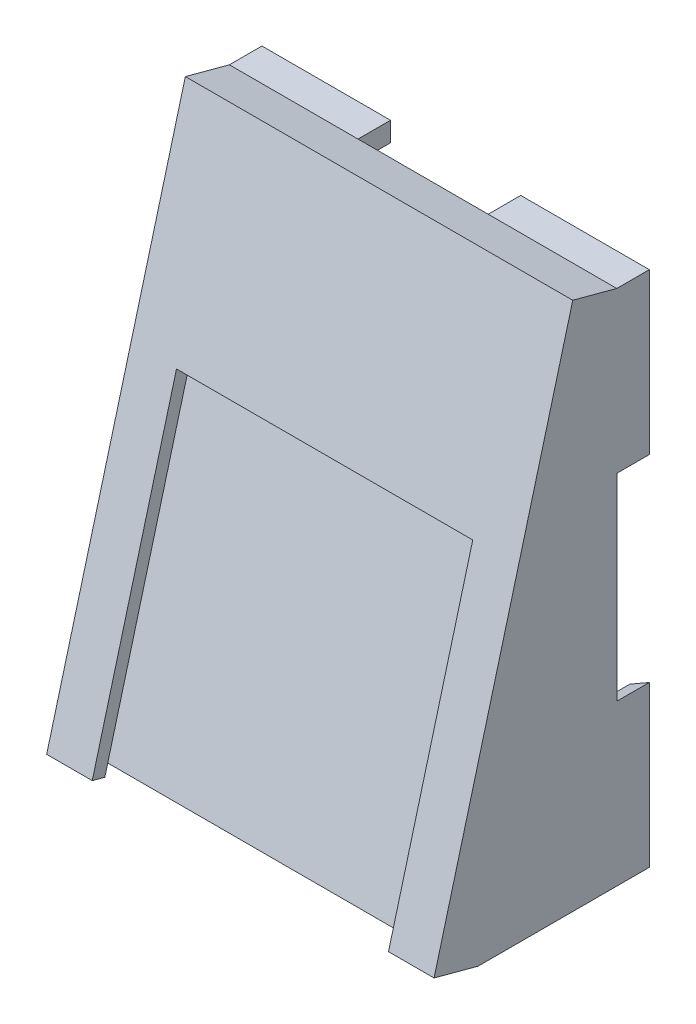
from build123d import *

# Parameters (mm, degrees)
BOSS_EXTRUDE1_DEPTH = 59.5
SKETCH4_W           = 55.5
SKETCH4_H           = 3
CUT_EXTRUDE1_DEPTH  = 80
SKETCH5_W           = 45.5
SKETCH5_H           = 2
CUT_EXTRUDE2_DEPTH  = 50
CUT_EXTRUDE3_START  = -3
CUT_EXTRUDE3_DEPTH  = 53.5
SKETCH7_W           = 20
SKETCH7_H           = 3
CUT_EXTRUDE4_DEPTH  = 5


with BuildPart() as part:
    # Sketch3 → Boss-Extrude1 (new body)
    with BuildSketch(Plane.YZ):
        Polygon((39.75, -2.5), (39.75, 2.5), (41.561733316, 9.261480784), (-37.938266684, 30.563441582), (-39.75, 23.801960798), (-39.75, -2.5), align=None)
    extrude(amount=BOSS_EXTRUDE1_DEPTH)

    # Sketch4 → Cut-Extrude1 (cut)
    with BuildSketch(Plane(origin=(0, -43.0377451, 11.531929044), x_dir=(1, 0, 0), z_dir=(0, -0.9659258262890679, 0.25881904510252235))):
        with Locations((29.75, 16.202871609)):
            Rectangle(SKETCH4_W, SKETCH4_H)
    extrude(amount=-CUT_EXTRUDE1_DEPTH, mode=Mode.SUBTRACT)

    # Sketch5 → Cut-Extrude2 (cut)
    with BuildSketch(Plane(origin=(0, -43.0377451, 11.531929044), x_dir=(1, 0, 0), z_dir=(0, -0.9659258262890679, 0.25881904510252235))):
        with Locations((29.75, 18.702871609)):
            Rectangle(SKETCH5_W, SKETCH5_H)
    extrude(amount=-CUT_EXTRUDE2_DEPTH, mode=Mode.SUBTRACT)

    # Sketch6 → Cut-Extrude3 (cut)
    with BuildSketch(Plane.YZ.offset(59.5).offset(CUT_EXTRUDE3_START)):
        Polygon((-36.75, -6.898480781), (-36.75, 22.511144618), (36.75, 2.816878974), (36.75, -6.898480781), align=None)
    extrude(amount=-CUT_EXTRUDE3_DEPTH, mode=Mode.SUBTRACT)

    # Sketch7 → Cut-Extrude4 (cut)
    with BuildSketch(Plane(origin=(0, 0, -2.5), x_dir=(1, 0, 0), z_dir=(0, 0, -1))):
        with Locations((29.75, 38.25)):
            Rectangle(SKETCH7_W, SKETCH7_H)
        Polygon((3, -16.887495374), (3, 16.887495374), (-26.25, 0), align=None)
        Polygon((56.5, -16.887495374), (85.75, 0), (56.5, 16.887495374), align=None)
        with Locations((29.75, -38.25)):
            Rectangle(SKETCH7_W, SKETCH7_H)
    extrude(amount=-CUT_EXTRUDE4_DEPTH, mode=Mode.SUBTRACT)


solid = part.part
